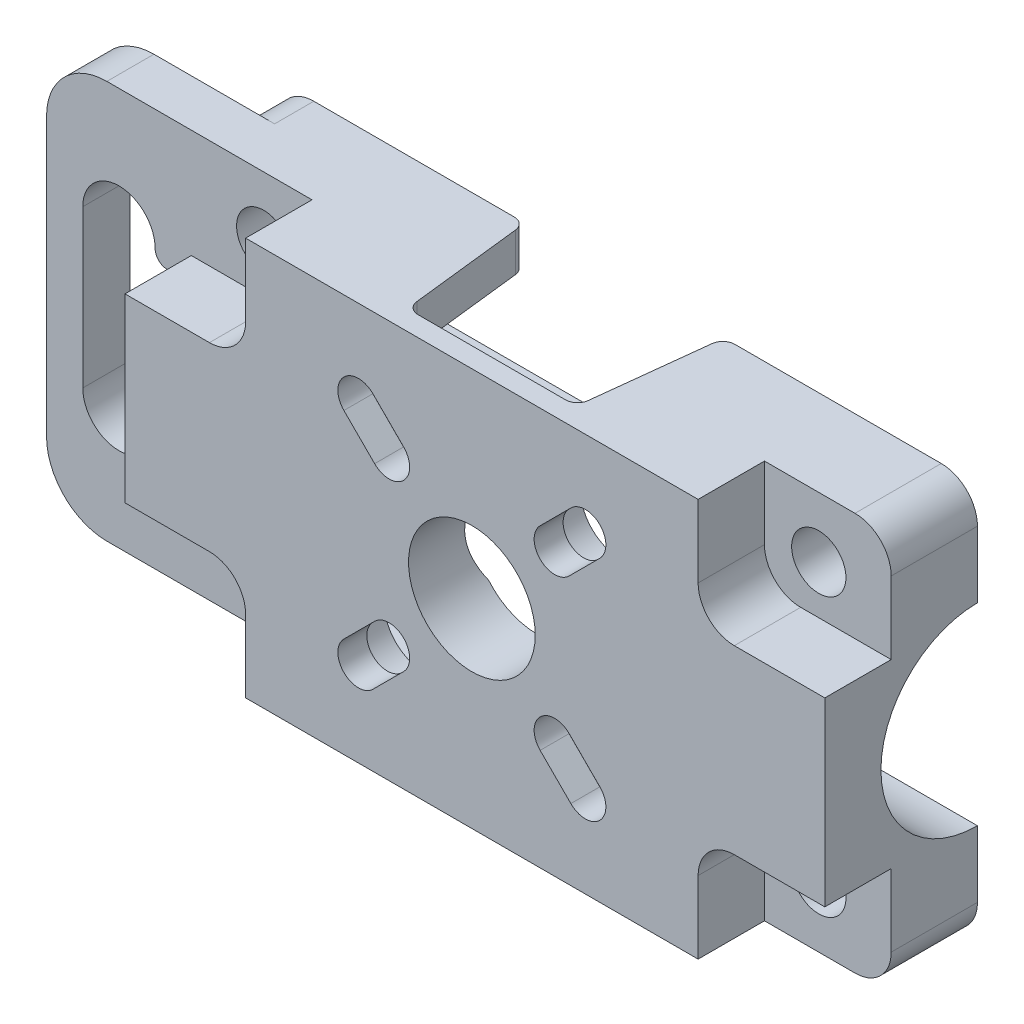
from build123d import *

# Parameters (mm, degrees)
BOSS_EXTRUDE1_DEPTH             = 12.65
CUT_EXTRUDE1_START              = -5.5
CUT_EXTRUDE1_DEPTH              = 5.5
CUT_EXTRUDE3_DEPTH              = 40.349364671
CUT_EXTRUDE4_DEPTH              = 58
CUT_EXTRUDE5_DEPTH              = 3.25
CUT_EXTRUDE6_DEPTH              = 7.25
M10_CLEARANCE_HOLE1_D           = 10.5
CBORE_START                     = 7.25
CBORE_SLOT_FOR_M3_SHCS1_DEPTH   = 3
CBORE_START_2                   = 10.25
CBORE_SLOT_FOR_M3_SHCS1_2_DEPTH = 2.4
CIRPATTERN1_COUNT               = 4
M4_CLEARANCE_HOLE1_D            = 4.5
BOSS_EXTRUDE2_START             = 4
BOSS_EXTRUDE2_DEPTH             = 4
CUT_EXTRUDE7_DEPTH              = 3.2
FILLET1_R                       = 1
FILLET1_OF_MIRROR1_R            = 1


# Read off the part's stored shape, not the designer's step: CBORE SLOT for M3 SHCS1
with BuildPart() as part:
    # Sketch2 → Boss-Extrude1 (new body)
    with BuildSketch(Plane.XY):
        with BuildLine():
            Line((32, 16.5), (-30, 16.5))
            ThreePointArc((-30, 16.5), (-33.535533906, 15.035533906), (-35, 11.5))
            Line((-35, 11.5), (-35, -11.5))
            ThreePointArc((-35, -11.5), (-33.535533906, -15.035533906), (-30, -16.5))
            Line((-30, -16.5), (32, -16.5))
            ThreePointArc((32, -16.5), (34.121320344, -15.621320344), (35, -13.5))
            Line((35, -13.5), (35, 13.5))
            ThreePointArc((35, 13.5), (34.121320344, 15.621320344), (32, 16.5))
        make_face()
    extrude(amount=BOSS_EXTRUDE1_DEPTH)

    # Sketch3 → Cut-Extrude1 (cut)
    with BuildSketch(Plane.XY.offset(12.65).offset(CUT_EXTRUDE1_START)):
        with BuildLine():
            Line((-13, 10.5), (-13, 16.5))
            Line((-13, 16.5), (-30, 16.5))
            ThreePointArc((-30, 16.5), (-33.535533906, 15.035533906), (-35, 11.5))
            Line((-35, 11.5), (-35, -11.5))
            ThreePointArc((-35, -11.5), (-33.535533906, -15.035533906), (-30, -16.5))
            Line((-30, -16.5), (-13, -16.5))
            Line((-13, -16.5), (-13, -10.5))
            ThreePointArc((-13, -10.5), (-13.878679656, -8.378679656), (-16, -7.5))
            Line((-16, -7.5), (-23, -7.5))
            Line((-23, -7.5), (-23, 7.5))
            Line((-23, 7.5), (-16, 7.5))
            ThreePointArc((-16, 7.5), (-13.878679656, 8.378679656), (-13, 10.5))
        make_face()
        with BuildLine():
            Line((32, 16.5), (24.5, 16.5))
            Line((24.5, 16.5), (24.5, 10.5))
            ThreePointArc((24.5, 10.5), (25.378679656, 8.378679656), (27.5, 7.5))
            Line((27.5, 7.5), (35, 7.5))
            Line((35, 7.5), (35, 13.5))
            ThreePointArc((35, 13.5), (34.121320344, 15.621320344), (32, 16.5))
        make_face()
        with BuildLine():
            Line((35, -13.5), (35, -7.5))
            Line((35, -7.5), (27.5, -7.5))
            ThreePointArc((27.5, -7.5), (25.378679656, -8.378679656), (24.5, -10.5))
            Line((24.5, -10.5), (24.5, -16.5))
            Line((24.5, -16.5), (32, -16.5))
            ThreePointArc((32, -16.5), (34.121320344, -15.621320344), (35, -13.5))
        make_face()
    extrude(amount=CUT_EXTRUDE1_DEPTH, mode=Mode.SUBTRACT)

    # Sketch5 → Cut-Extrude3 (cut, through all)
    with BuildSketch(Plane.XY.offset(7.15)):
        with BuildLine():
            Line((-23, -5.5), (-24.995769837, -5.5))
            ThreePointArc((-24.995769837, -5.5), (-25.705460123, -5.793963342), (-25.999423465, -6.503653628))
            ThreePointArc((-25.999423465, -6.503653628), (-28.999423465, -9.503653628), (-31.999423465, -6.503653628))
            Line((-31.999423465, -6.503653628), (-31.999423465, 6.503653628))
            ThreePointArc((-31.999423465, 6.503653628), (-28.999423465, 9.503653628), (-25.999423465, 6.503653628))
            ThreePointArc((-25.999423465, 6.503653628), (-25.705460123, 5.793963342), (-24.995769837, 5.5))
            Line((-24.995769837, 5.5), (-23, 5.5))
            Line((-23, 5.5), (-23, -5.5))
        make_face()
    extrude(amount=-CUT_EXTRUDE3_DEPTH, mode=Mode.SUBTRACT)

    # Sketch4 → Cut-Extrude4 (cut)
    with BuildSketch(Plane(origin=(35, 0, 0), x_dir=(0, 0, -1), z_dir=(1, 0, 0))):
        with BuildLine():
            Line((0, -8), (0, 8))
            ThreePointArc((0, 8), (-8, 0), (0, -8))
        make_face()
    extrude(amount=-CUT_EXTRUDE4_DEPTH, mode=Mode.SUBTRACT)

    # Sketch6 → Cut-Extrude5 (cut)
    with BuildSketch(Plane(origin=(0, 0, 0), x_dir=(-1, 0, 0), z_dir=(0, 0, -1))):
        with BuildLine():
            Line((30, -16.5), (20, -16.5))
            ThreePointArc((20, -16.5), (22.121320344, -15.621320344), (23, -13.5))
            Line((23, -13.5), (23, 13.5))
            ThreePointArc((23, 13.5), (22.121320344, 15.621320344), (20, 16.5))
            Line((20, 16.5), (30, 16.5))
            ThreePointArc((30, 16.5), (33.535533906, 15.035533906), (35, 11.5))
            Line((35, 11.5), (35, -11.5))
            ThreePointArc((35, -11.5), (33.535533906, -15.035533906), (30, -16.5))
        make_face()
    extrude(amount=-CUT_EXTRUDE5_DEPTH, mode=Mode.SUBTRACT)

    # Sketch7 → Cut-Extrude6 (cut)
    with BuildSketch(Plane(origin=(0, 0, 0), x_dir=(-1, 0, 0), z_dir=(0, 0, -1))):
        with BuildLine():
            Line((9.5, -13.3), (-21.5, -13.3))
            ThreePointArc((-21.5, -13.3), (-22.914213562, -12.714213562), (-23.5, -11.3))
            Line((-23.5, -11.3), (-23.5, 11.3))
            ThreePointArc((-23.5, 11.3), (-22.914213562, 12.714213562), (-21.5, 13.3))
            Line((-21.5, 13.3), (9.5, 13.3))
            ThreePointArc((9.5, 13.3), (10.914213562, 12.714213562), (11.5, 11.3))
            Line((11.5, 11.3), (11.5, -11.3))
            ThreePointArc((11.5, -11.3), (10.914213562, -12.714213562), (9.5, -13.3))
        make_face()
    extrude(amount=-CUT_EXTRUDE6_DEPTH, mode=Mode.SUBTRACT)

    # M10 Clearance Hole1 (through all)
    with Locations(Plane.XY.offset(12.65)):
        with Locations((5.75, 0)):
            Hole(M10_CLEARANCE_HOLE1_D / 2)

    # CBORE SLOT for M3 SHCS1 outline → CBORE SLOT for M3 SHCS1 (cut)
    with BuildSketch(Plane.XY.offset(CBORE_START)):
        with BuildLine():
            ThreePointArc((12.856423151, -11.702617229), (17.452617229, -11.702617229), (17.452617229, -7.106423151))
            Line((17.452617229, -7.106423151), (14.907032816, -4.560838739))
            ThreePointArc((14.907032816, -4.560838739), (10.310838739, -4.560838739), (10.310838739, -9.157032816))
            Line((10.310838739, -9.157032816), (12.856423151, -11.702617229))
        make_face()
    cbore_slot_for_m3_shcs1 = extrude(amount=CBORE_SLOT_FOR_M3_SHCS1_DEPTH, mode=Mode.SUBTRACT)

    # CBORE SLOT for M3 SHCS1 2 outline → CBORE SLOT for M3 SHCS1 2 (cut)
    with BuildSketch(Plane.XY.offset(CBORE_START_2)):
        with BuildLine():
            ThreePointArc((13.952438662, -10.606601718), (16.356601718, -10.606601718), (16.356601718, -8.202438662))
            Line((16.356601718, -8.202438662), (13.811017306, -5.656854249))
            ThreePointArc((13.811017306, -5.656854249), (11.406854249, -5.656854249), (11.406854249, -8.061017306))
            Line((11.406854249, -8.061017306), (13.952438662, -10.606601718))
        make_face()
    cbore_slot_for_m3_shcs1_2 = extrude(amount=CBORE_SLOT_FOR_M3_SHCS1_2_DEPTH, mode=Mode.SUBTRACT)

    # CirPattern1: CBORE SLOT for M3 SHCS1, CBORE SLOT for M3 SHCS1 2 ×4 about axis
    cirpattern1_axis = Axis((5.75, 0, 0), (0, 0, 1))
    add([cbore_slot_for_m3_shcs1.rotate(cirpattern1_axis, i * 360 / CIRPATTERN1_COUNT) for i in range(1, CIRPATTERN1_COUNT)], mode=Mode.SUBTRACT)
    add([cbore_slot_for_m3_shcs1_2.rotate(cirpattern1_axis, i * 360 / CIRPATTERN1_COUNT) for i in range(1, CIRPATTERN1_COUNT)], mode=Mode.SUBTRACT)

    # M4 Clearance Hole1 (through all)
    with Locations(Plane.XY.offset(7.15)):
        with Locations((29, -11.5), (29, 11.5), (-17, 11.5), (-17, -11.5)):
            Hole(M4_CLEARANCE_HOLE1_D / 2)

    # Sketch19 → Boss-Extrude2 (add)
    with BuildSketch(Plane(origin=(-23, 0, 0), x_dir=(0, 0, -1), z_dir=(1, 0, 0)).offset(BOSS_EXTRUDE2_START)):
        with BuildLine():
            Line((-3.25, 5.5), (-3.25, 7.310095759))
            ThreePointArc((-3.25, 7.310095759), (-4.619267644, 6.531643471), (-5.809475019, 5.5))
            Line((-5.809475019, 5.5), (-3.25, 5.5))
        make_face()
        with BuildLine():
            Line((-3.25, -7.310095759), (-3.25, -5.5))
            Line((-3.25, -5.5), (-5.809475019, -5.5))
            ThreePointArc((-5.809475019, -5.5), (-4.619267644, -6.531643471), (-3.25, -7.310095759))
        make_face()
    extrude(amount=-BOSS_EXTRUDE2_DEPTH)

    # Sketch20 → Cut-Extrude7 (cut)
    with BuildSketch(Plane(origin=(0, 16.5, 0), x_dir=(1, 0, 0), z_dir=(0, 1, 0))):
        Polygon((-2.5, 0), (14, 0), (12.75, -11), (-1.25, -11), align=None)
    cut_extrude7 = extrude(amount=-CUT_EXTRUDE7_DEPTH, mode=Mode.SUBTRACT)

    # Fillet1
    fillet1_edges = [part.edges().sort_by_distance(p)[0] for p in [
        (-1.25, 14.9, 11),
        (-2.5, 14.9, 0),
        (14, 14.9, 0),
        (12.75, 14.9, 11),
    ]]
    fillet(fillet1_edges, radius=FILLET1_R)

    # Mirror1: Cut-Extrude7 across plane
    add(cut_extrude7.mirror(Plane.ZX), mode=Mode.SUBTRACT)

    # Fillet1 of Mirror1
    fillet1_of_mirror1_edges = [part.edges().sort_by_distance(p)[0] for p in [
        (-1.25, -14.9, 11),
        (-2.5, -14.9, 0),
        (14, -14.9, 0),
        (12.75, -14.9, 11),
    ]]
    fillet(fillet1_of_mirror1_edges, radius=FILLET1_OF_MIRROR1_R)


solid = part.part
